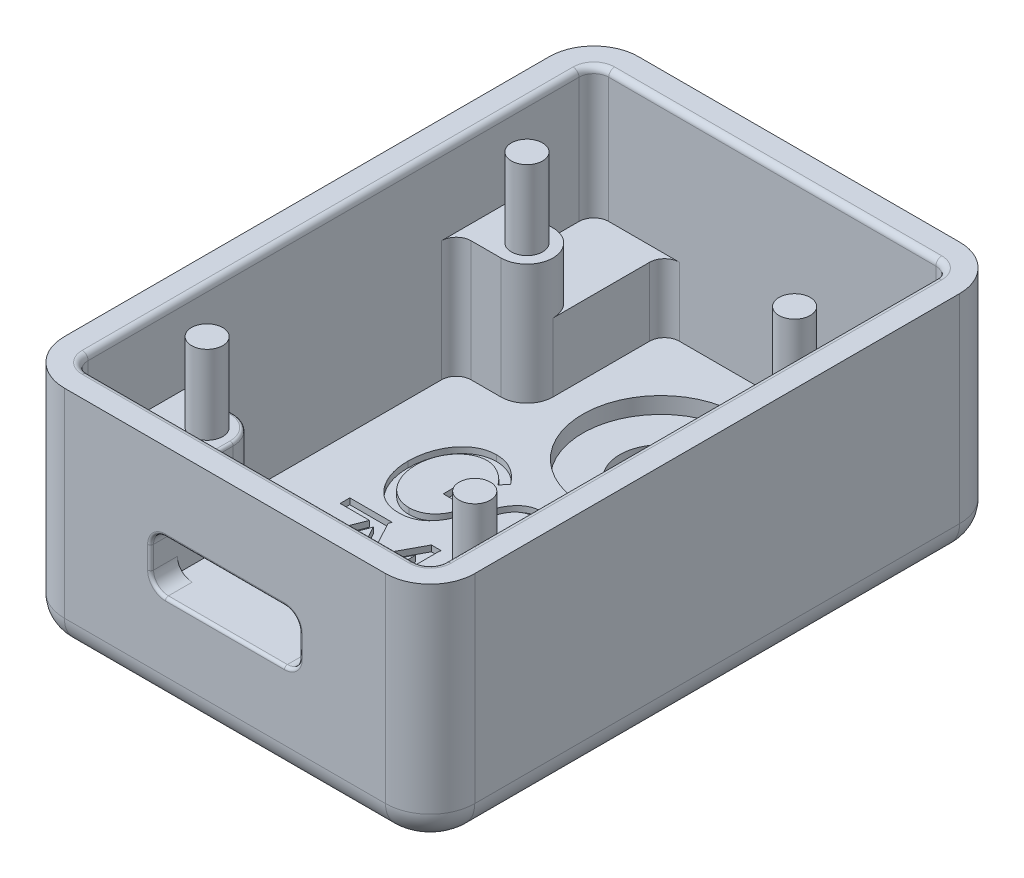
from build123d import *

# Parameters (mm, degrees)
SKETCH_1_3_W        = 27.6
SKETCH_1_3_H        = 38.61
EXTRUDE_2_DEPTH     = 5.3
SKETCH_1_3_R        = 1.05
EXTRUDE_2_2_DEPTH   = 5.3
EXTRUDE_2_3_DEPTH   = 5.3
EXTRUDE_2_4_DEPTH   = 5.3
EXTRUDE_2_5_DEPTH   = 5.3
EXTRUDE_START       = -8.1
SKETCH_1_W          = 27.6
SKETCH_1_H          = 38.61
EXTRUDE_3_DEPTH     = 8.1
EXTRUDE_4_DEPTH     = 4.6
CUT_EXTRUDE_1_DEPTH = 2.3
SKETCH_1_6_W        = 27.6
SKETCH_1_6_H        = 38.61
EXTRUDE_5_DEPTH     = 2
EXTRUDE_6_DEPTH     = 4.6
FILLET_1_R          = 3
FILLET_2_R          = 0.2
FILLET_3_R          = 2
SKETCH_3_7_R        = 2.75
CUT_EXTRUDE_2_DEPTH = 3
SKETCH_3_8_R        = 5.25
SKETCH_3_8_R_2      = 2.75
CUT_EXTRUDE_3_DEPTH = 1.1
FILLET_4_R          = 0.4
FILLET_5_R          = 0.4
CUT_EXTRUDE_4_DEPTH = 0.4
CUT_EXTRUDE_5_DEPTH = 0.4


with BuildPart() as part:
    # 草图1<3> → 凸台-拉伸2 (new body)
    with BuildSketch(Plane(origin=(0, 0, 0), x_dir=(1, 0, 0), z_dir=(0, 1, 0))):
        with Locations((0, 0.75)):
            Rectangle(SKETCH_1_3_W, SKETCH_1_3_H)
        with BuildLine():
            ThreePointArc((-12, 17.255), (-11.707106781, 17.962106781), (-11, 18.255))
            Line((-11, 18.255), (11, 18.255))
            ThreePointArc((11, 18.255), (11.707106781, 17.962106781), (12, 17.255))
            Line((12, 17.255), (12, -15.755))
            ThreePointArc((12, -15.755), (11.707106781, -16.462106781), (11, -16.755))
            Line((11, -16.755), (-11, -16.755))
            ThreePointArc((-11, -16.755), (-11.707106781, -16.462106781), (-12, -15.755))
            Line((-12, -15.755), (-12, 17.255))
        make_face(mode=Mode.SUBTRACT)
    extrude(amount=EXTRUDE_2_DEPTH)

    # 草图1 → 凸台-拉伸3 (add)
    with BuildSketch(Plane(origin=(0, 0, 0), x_dir=(1, 0, 0), z_dir=(0, 1, 0)).offset(EXTRUDE_START)):
        with Locations((0, 0.75)):
            Rectangle(SKETCH_1_W, SKETCH_1_H)
        with BuildLine():
            ThreePointArc((-12, 17.255), (-11.707106781, 17.962106781), (-11, 18.255))
            Line((-11, 18.255), (11, 18.255))
            ThreePointArc((11, 18.255), (11.707106781, 17.962106781), (12, 17.255))
            Line((12, 17.255), (12, 13.505))
            ThreePointArc((12, 13.505), (11.707106781, 12.797893219), (11, 12.505))
            Line((11, 12.505), (9, 12.505))
            ThreePointArc((9, 12.505), (7.25, 10.755), (9, 9.005))
            Line((9, 9.005), (11, 9.005))
            ThreePointArc((11, 9.005), (11.707106781, 8.712106781), (12, 8.005))
            Line((12, 8.005), (12, -8.005))
            ThreePointArc((12, -8.005), (11.707106781, -8.712106781), (11, -9.005))
            Line((11, -9.005), (9, -9.005))
            ThreePointArc((9, -9.005), (7.762563133, -9.517563133), (7.25, -10.755))
            Line((7.25, -10.755), (7.25, -12.755))
            ThreePointArc((7.25, -12.755), (6.957106781, -13.462106781), (6.25, -13.755))
            Line((6.25, -13.755), (5, -13.755))
            Line((5, -13.755), (5, -16.755))
            Line((5, -16.755), (-5, -16.755))
            Line((-5, -16.755), (-5, -13.755))
            Line((-5, -13.755), (-6.25, -13.755))
            ThreePointArc((-6.25, -13.755), (-6.957106781, -13.462106781), (-7.25, -12.755))
            Line((-7.25, -12.755), (-7.25, -10.755))
            ThreePointArc((-7.25, -10.755), (-7.762563133, -9.517563133), (-9, -9.005))
            Line((-9, -9.005), (-11, -9.005))
            ThreePointArc((-11, -9.005), (-11.707106781, -8.712106781), (-12, -8.005))
            Line((-12, -8.005), (-12, 8.005))
            ThreePointArc((-12, 8.005), (-11.707106781, 8.712106781), (-11, 9.005))
            Line((-11, 9.005), (-9, 9.005))
            ThreePointArc((-9, 9.005), (-7.25, 10.755), (-9, 12.505))
            Line((-9, 12.505), (-11, 12.505))
            ThreePointArc((-11, 12.505), (-11.707106781, 12.797893219), (-12, 13.505))
            Line((-12, 13.505), (-12, 17.255))
        make_face(mode=Mode.SUBTRACT)
    extrude(amount=EXTRUDE_3_DEPTH)

    # 草图1<5> → 凸台-拉伸4 (add)
    with BuildSketch(Plane(origin=(0, 0, 0), x_dir=(1, 0, 0), z_dir=(0, 1, 0)).offset(EXTRUDE_START)):
        with BuildLine():
            Line((7.876917987, -9.412916995), (7.535564854, -9.005))
            Line((7.535564854, -9.005), (-9, -9.005))
            ThreePointArc((-9, -9.005), (-7.762563133, -9.517563133), (-7.25, -10.755))
            Line((-7.25, -10.755), (-7.25, -12.755))
            ThreePointArc((-7.25, -12.755), (-6.957106781, -13.462106781), (-6.25, -13.755))
            Line((-6.25, -13.755), (-5, -13.755))
            Line((-5, -13.755), (-5, -16.755))
            Line((-5, -16.755), (5, -16.755))
            Line((5, -16.755), (5, -13.755))
            Line((5, -13.755), (6.25, -13.755))
            ThreePointArc((6.25, -13.755), (6.957106781, -13.462106781), (7.25, -12.755))
            Line((7.25, -12.755), (7.25, -10.755))
            ThreePointArc((7.25, -10.755), (7.414456951, -10.0143562), (7.876917987, -9.412916995))
        make_face()
        with BuildLine():
            Line((9, -9.005), (7.535564854, -9.005))
            Line((7.535564854, -9.005), (7.876917987, -9.412916995))
            ThreePointArc((7.876917987, -9.412916995), (8.402566012, -9.110137504), (9, -9.005))
        make_face()
    extrude(amount=EXTRUDE_4_DEPTH)

    # 草图2 → 切除-拉伸1 (cut)
    with BuildSketch(Plane.XY.offset(18.555)):
        with BuildLine():
            Line((-5, -1), (-5, -2.5))
            ThreePointArc((-5, -2.5), (-4.707106781, -3.207106781), (-4, -3.5))
            Line((-4, -3.5), (4, -3.5))
            ThreePointArc((4, -3.5), (4.707106781, -3.207106781), (5, -2.5))
            Line((5, -2.5), (5, -1))
            ThreePointArc((5, -1), (4.707106781, -0.292893219), (4, 0))
            Line((4, 0), (-4, 0))
            ThreePointArc((-4, 0), (-4.707106781, -0.292893219), (-5, -1))
        make_face()
    extrude(amount=-CUT_EXTRUDE_1_DEPTH, mode=Mode.SUBTRACT)

    # 草图1<6> → 凸台-拉伸5 (add)
    with BuildSketch(Plane(origin=(0, 0, 0), x_dir=(1, 0, 0), z_dir=(0, 1, 0)).offset(EXTRUDE_START)):
        with Locations((0, 0.75)):
            Rectangle(SKETCH_1_6_W, SKETCH_1_6_H)
    extrude(amount=-EXTRUDE_5_DEPTH)

    # 草图3 → 凸台-拉伸6 (add)
    with BuildSketch(Plane(origin=(0, -8.1, 0), x_dir=(1, 0, 0), z_dir=(0, 1, 0))):
        with BuildLine():
            Line((-6.25, 18.255), (-11, 18.255))
            ThreePointArc((-11, 18.255), (-11.707106781, 17.962106781), (-12, 17.255))
            Line((-12, 17.255), (-12, 13.505))
            ThreePointArc((-12, 13.505), (-11.707106781, 12.797893219), (-11, 12.505))
            Line((-11, 12.505), (-9, 12.505))
            ThreePointArc((-9, 12.505), (-7.762563133, 11.992436867), (-7.25, 10.755))
            Line((-7.25, 10.755), (-7.25, 17.255))
            ThreePointArc((-7.25, 17.255), (-6.957106781, 17.962106781), (-6.25, 18.255))
        make_face()
        with BuildLine():
            Line((11, 18.255), (6.25, 18.255))
            ThreePointArc((6.25, 18.255), (6.957106781, 17.962106781), (7.25, 17.255))
            Line((7.25, 17.255), (7.25, 10.755))
            ThreePointArc((7.25, 10.755), (7.762563133, 11.992436867), (9, 12.505))
            Line((9, 12.505), (11, 12.505))
            ThreePointArc((11, 12.505), (11.707106781, 12.797893219), (12, 13.505))
            Line((12, 13.505), (12, 17.255))
            ThreePointArc((12, 17.255), (11.707106781, 17.962106781), (11, 18.255))
        make_face()
    extrude(amount=EXTRUDE_6_DEPTH)

    # 圆角1
    fillet_1_edges = [part.edges().sort_by_distance(p)[0] for p in [
        (13.8, -2.4, 18.555),
        (-13.8, -2.4, 18.555),
        (-13.8, -2.4, -20.055),
        (13.8, -2.4, -20.055),
    ]]
    fillet(fillet_1_edges, radius=FILLET_1_R)

    # 圆角2
    # the kernel refuses this fillet: 0.2 mm, written as the material it takes off along each edge
    with BuildSketch(Plane(origin=(5.2, -0.2, 13.955), x_dir=(0, 1, 0), z_dir=(0, 0, -1))) as fillet_2_piece_1_section:
        Polygon((0, 0), (FILLET_2_R * 1.02, 0), (FILLET_2_R * 1.02, -FILLET_2_R * 1.02), (0, -FILLET_2_R * 1.02), align=None)
    fillet_2_piece_1 = extrude(amount=FILLET_2_R * 1.02, mode=Mode.PRIVATE)
    fillet_2_piece_1 = fillet_2_piece_1 - Plane(origin=(5.2, -0.2, 13.955), x_dir=(0.7071067811865475, -0.7071067811865475, 0), z_dir=(0, 0, -1)) * Sphere(FILLET_2_R, mode=Mode.PRIVATE)
    add(fillet_2_piece_1, mode=Mode.SUBTRACT)
    with BuildSketch(Plane(origin=(-5.2, -0.2, 13.955), x_dir=(1, 0, 0), z_dir=(0, 0, -1))) as fillet_2_piece_2_section:
        Polygon((0, 0), (FILLET_2_R * 1.02, 0), (FILLET_2_R * 1.02, -FILLET_2_R * 1.02), (0, -FILLET_2_R * 1.02), align=None)
    fillet_2_piece_2 = extrude(amount=FILLET_2_R * 1.02, mode=Mode.PRIVATE)
    fillet_2_piece_2 = fillet_2_piece_2 - Plane(origin=(-5.2, -0.2, 13.955), x_dir=(-0.7071067811865475, -0.7071067811865475, 0), z_dir=(0, 0, -1)) * Sphere(FILLET_2_R, mode=Mode.PRIVATE)
    add(fillet_2_piece_2, mode=Mode.SUBTRACT)
    with BuildSketch(Plane(origin=(5, -3.5, 13.755), x_dir=(0, 0, 1), z_dir=(0, 1, 0))) as fillet_2_piece_3:
        with BuildLine():
            CenterArc((FILLET_2_R, FILLET_2_R), FILLET_2_R, 180, 90)
            Line((0, FILLET_2_R), (0, 0))
            Line((0, 0), (FILLET_2_R, 0))
        make_face()
    extrude(amount=3.3, mode=Mode.SUBTRACT)
    with BuildSketch(Plane(origin=(-5, -3.5, 13.755), x_dir=(0, 0, 1), z_dir=(0, 1, 0))) as fillet_2_piece_4:
        with BuildLine():
            CenterArc((FILLET_2_R, -FILLET_2_R), FILLET_2_R, 90, 90)
            Line((0, -FILLET_2_R), (0, 0))
            Line((0, 0), (FILLET_2_R, 0))
        make_face()
    extrude(amount=3.3, mode=Mode.SUBTRACT)
    with BuildSketch(Plane(origin=(4, -1, 18.555), x_dir=(1, 0, 0), z_dir=(0, -1, 0))) as fillet_2_piece_5:
        with BuildLine():
            CenterArc((1 + FILLET_2_R, -FILLET_2_R), FILLET_2_R, 90, 90)
            Line((1, -FILLET_2_R), (1, 0))
            Line((1, 0), (1 + FILLET_2_R, 0))
        make_face()
    revolve(axis=Axis((4, -1, 18.555), (0, 0, 1)), revolution_arc=90, mode=Mode.SUBTRACT)
    with BuildSketch(Plane(origin=(-4, -2.5, 18.555), x_dir=(-1, 0, 0), z_dir=(0, 1, 0))) as fillet_2_piece_6:
        with BuildLine():
            CenterArc((1 + FILLET_2_R, -FILLET_2_R), FILLET_2_R, 90, 90)
            Line((1, -FILLET_2_R), (1, 0))
            Line((1, 0), (1 + FILLET_2_R, 0))
        make_face()
    revolve(axis=Axis((-4, -2.5, 18.555), (0, 0, 1)), revolution_arc=90, mode=Mode.SUBTRACT)
    with BuildSketch(Plane(origin=(-5, -1, 18.555), x_dir=(-1, 0, 0), z_dir=(0, -1, 0)), Plane(origin=(5, -2.5, 18.555), x_dir=(1, 0, 0), z_dir=(0, 1, 0))) as fillet_2_piece_7:
        with BuildLine():
            CenterArc((FILLET_2_R, FILLET_2_R), FILLET_2_R, 180, 90)
            Line((0, FILLET_2_R), (0, 0))
            Line((0, 0), (FILLET_2_R, 0))
        make_face()
    extrude(amount=1.5, mode=Mode.SUBTRACT)
    with BuildSketch(Plane(origin=(4, 0, 18.555), x_dir=(0, 1, 0), z_dir=(-1, 0, 0)), Plane(origin=(-4, -3.5, 18.555), x_dir=(0, -1, 0), z_dir=(1, 0, 0))) as fillet_2_piece_8:
        with BuildLine():
            CenterArc((FILLET_2_R, FILLET_2_R), FILLET_2_R, 180, 90)
            Line((0, FILLET_2_R), (0, 0))
            Line((0, 0), (FILLET_2_R, 0))
        make_face()
    extrude(amount=8, mode=Mode.SUBTRACT)
    with BuildSketch(Plane(origin=(-4, -1, 18.555), x_dir=(0, 1, 0), z_dir=(1, 0, 0))) as fillet_2_piece_9:
        with BuildLine():
            CenterArc((1 + FILLET_2_R, -FILLET_2_R), FILLET_2_R, 90, 90)
            Line((1, -FILLET_2_R), (1, 0))
            Line((1, 0), (1 + FILLET_2_R, 0))
        make_face()
    revolve(axis=Axis((-4, -1, 18.555), (0, 0, 1)), revolution_arc=90, mode=Mode.SUBTRACT)
    with BuildSketch(Plane(origin=(4, -2.5, 18.555), x_dir=(0, -1, 0), z_dir=(-1, 0, 0))) as fillet_2_piece_10:
        with BuildLine():
            CenterArc((1 + FILLET_2_R, -FILLET_2_R), FILLET_2_R, 90, 90)
            Line((1, -FILLET_2_R), (1, 0))
            Line((1, 0), (1 + FILLET_2_R, 0))
        make_face()
    revolve(axis=Axis((4, -2.5, 18.555), (0, 0, 1)), revolution_arc=90, mode=Mode.SUBTRACT)
    with BuildSketch(Plane(origin=(9, 0, 10.755), x_dir=(0, 0, -1), z_dir=(1, 0, 0))) as fillet_2_piece_11:
        with BuildLine():
            CenterArc((1.75 - FILLET_2_R, -FILLET_2_R), FILLET_2_R, 360, 90)
            Line((1.75, -FILLET_2_R), (1.75, 0))
            Line((1.75, 0), (1.75 - FILLET_2_R, 0))
        make_face()
    revolve(axis=Axis((9, 0, 10.755), (0, 1, 0)), revolution_arc=90, mode=Mode.SUBTRACT)
    with BuildSketch(Plane(origin=(7.25, 0, 10.755), x_dir=(1, 0, 0), z_dir=(0, 0, 1)), Plane(origin=(11, 0, 9.005), x_dir=(0, 0, 1), z_dir=(-1, 0, 0)), Plane(origin=(-7.25, 0, 12.755), x_dir=(-1, 0, 0), z_dir=(0, 0, -1)), Plane(origin=(-9, 0, 9.005), x_dir=(0, 0, 1), z_dir=(-1, 0, 0))) as fillet_2_piece_12:
        with BuildLine():
            CenterArc((FILLET_2_R, -FILLET_2_R), FILLET_2_R, 90, 90)
            Line((0, -FILLET_2_R), (0, 0))
            Line((0, 0), (FILLET_2_R, 0))
        make_face()
    extrude(amount=2, mode=Mode.SUBTRACT)
    with BuildSketch(Plane(origin=(6.25, 0, 12.755), x_dir=(1, 0, 0), z_dir=(0, 0, -1))) as fillet_2_piece_13:
        with BuildLine():
            CenterArc((1 + FILLET_2_R, FILLET_2_R), FILLET_2_R, 180, 90)
            Line((1, FILLET_2_R), (1, 0))
            Line((1, 0), (1 + FILLET_2_R, 0))
        make_face()
    revolve(axis=Axis((6.25, 0, 12.755), (0, -1, 0)), revolution_arc=90, mode=Mode.SUBTRACT)
    with BuildSketch(Plane(origin=(6.25, 0, 13.755), x_dir=(0, 0, 1), z_dir=(-1, 0, 0)), Plane(origin=(-5.2, 0, 13.755), x_dir=(0, 0, 1), z_dir=(-1, 0, 0))) as fillet_2_piece_14:
        with BuildLine():
            CenterArc((FILLET_2_R, -FILLET_2_R), FILLET_2_R, 90, 90)
            Line((0, -FILLET_2_R), (0, 0))
            Line((0, 0), (FILLET_2_R, 0))
        make_face()
    extrude(amount=1.05, mode=Mode.SUBTRACT)
    with BuildSketch(Plane(origin=(5, 0, 13.955), x_dir=(0, -1, 0), z_dir=(0, 0, 1)), Plane(origin=(-5, 0, 16.755), x_dir=(0, -1, 0), z_dir=(0, 0, -1))) as fillet_2_piece_15:
        with BuildLine():
            CenterArc((FILLET_2_R, FILLET_2_R), FILLET_2_R, 180, 90)
            Line((0, FILLET_2_R), (0, 0))
            Line((0, 0), (FILLET_2_R, 0))
        make_face()
    extrude(amount=2.8, mode=Mode.SUBTRACT)
    with BuildSketch(Plane(origin=(11, 0, 8.005), x_dir=(0.8774862496148653, 0, -0.47960179496832406), z_dir=(-0.47960179496832406, 0, -0.8774862496148653))) as fillet_2_piece_16_section:
        with BuildLine():
            CenterArc((1 + FILLET_2_R, FILLET_2_R), FILLET_2_R, 180, 90)
            Line((1 + FILLET_2_R, 0), (1, 0))
            Line((1, 0), (1, FILLET_2_R))
        make_face()
    fillet_2_piece_16 = revolve(axis=Axis((11, 0, 8.005), (0, -1, 0)), revolution_arc=118.659397847, mode=Mode.PRIVATE)
    fillet_2_piece_16 = split(fillet_2_piece_16, bisect_by=Plane(origin=(12, -0.057092047, 8.752476907), z_dir=(-1, 0, 0)), keep=Keep.TOP, mode=Mode.PRIVATE)
    add(fillet_2_piece_16, mode=Mode.SUBTRACT)
    with BuildSketch(Plane(origin=(-6.25, 0, 12.755), x_dir=(0, 0, 1), z_dir=(1, 0, 0))) as fillet_2_piece_17:
        with BuildLine():
            CenterArc((1 + FILLET_2_R, FILLET_2_R), FILLET_2_R, 180, 90)
            Line((1, FILLET_2_R), (1, 0))
            Line((1, 0), (1 + FILLET_2_R, 0))
        make_face()
    revolve(axis=Axis((-6.25, 0, 12.755), (0, -1, 0)), revolution_arc=90, mode=Mode.SUBTRACT)
    with BuildSketch(Plane(origin=(-9, 0, 10.755), x_dir=(1, 0, 0), z_dir=(0, 0, 1))) as fillet_2_piece_18:
        with BuildLine():
            CenterArc((1.75 - FILLET_2_R, -FILLET_2_R), FILLET_2_R, 360, 90)
            Line((1.75, -FILLET_2_R), (1.75, 0))
            Line((1.75, 0), (1.75 - FILLET_2_R, 0))
        make_face()
    revolve(axis=Axis((-9, 0, 10.755), (0, 1, 0)), revolution_arc=90, mode=Mode.SUBTRACT)
    with BuildSketch(Plane(origin=(-11, 0, 8.005), x_dir=(0, 0, 1), z_dir=(1, 0, 0))) as fillet_2_piece_19_section:
        with BuildLine():
            CenterArc((1 + FILLET_2_R, FILLET_2_R), FILLET_2_R, 180, 90)
            Line((1, FILLET_2_R), (1, 0))
            Line((1, 0), (1 + FILLET_2_R, 0))
        make_face()
    fillet_2_piece_19 = revolve(axis=Axis((-11, 0, 8.005), (0, -1, 0)), revolution_arc=118.659397847, mode=Mode.PRIVATE)
    fillet_2_piece_19 = split(fillet_2_piece_19, bisect_by=Plane(origin=(-12, -0.03305376, 9.046826164), z_dir=(1, 0, 0)), keep=Keep.TOP, mode=Mode.PRIVATE)
    add(fillet_2_piece_19, mode=Mode.SUBTRACT)

    # 圆角3
    fillet_3_edges = [part.edges().sort_by_distance(p)[0] for p in [
        (-13.8, -10.1, -0.75),
        (13.8, -10.1, -0.75),
        (0, -10.1, 18.555),
        (0, -10.1, -20.055),
        (-12.921320344, -10.1, 17.676320344),
        (12.921320344, -10.1, 17.676320344),
        (12.921320344, -10.1, -19.176320344),
        (-12.921320344, -10.1, -19.176320344),
    ]]
    fillet(fillet_3_edges, radius=FILLET_3_R)

    # 草图3<7> → 切除-拉伸2 (cut)
    with BuildSketch(Plane(origin=(0, -8.1, 0), x_dir=(1, 0, 0), z_dir=(0, 1, 0))):
        with Locations(Location((0, 10.755, 0), (0, 0, 270))):
            Circle(SKETCH_3_7_R)
    extrude(amount=-CUT_EXTRUDE_2_DEPTH, mode=Mode.SUBTRACT)

    # 草图3<8> → 切除-拉伸3 (cut)
    with BuildSketch(Plane(origin=(0, -8.1, 0), x_dir=(1, 0, 0), z_dir=(0, 1, 0))):
        with Locations(Location((0, 10.755, 0), (0, 0, 270))):
            Circle(SKETCH_3_8_R)
        with Locations(Location((0, 10.755, 0), (0, 0, 270))):
            Circle(SKETCH_3_8_R_2, mode=Mode.SUBTRACT)
    extrude(amount=-CUT_EXTRUDE_3_DEPTH, mode=Mode.SUBTRACT)

    # 圆角4
    fillet_4_edges = [part.edges().sort_by_distance(p)[0] for p in [
        (0, -10.1, -13.505),
    ]]
    fillet(fillet_4_edges, radius=FILLET_4_R)

    # 圆角5
    fillet_5_edges = [part.edges().sort_by_distance(p)[0] for p in [
        (12, 5.3, -0.75),
        (11.707106781, 5.3, 16.462106781),
        (0, 5.3, 16.755),
        (-11.707106781, 5.3, 16.462106781),
        (-12, 5.3, -0.75),
        (-11.707106781, 5.3, -17.962106781),
        (0, 5.3, -18.255),
        (11.707106781, 5.3, -17.962106781),
    ]]
    fillet(fillet_5_edges, radius=FILLET_5_R)

    # 草图4 → 切除-拉伸4 (cut)
    # profile 1 of 4: a face of its own
    with BuildSketch(Plane(origin=(0, -8.1, 0), x_dir=(1, 0, 0), z_dir=(0, 1, 0))):
        with BuildLine():
            Line((-3.590091151, 4.248976752), (-3.970429693, 3.785955919))
            add(Edge.make_bspline(
                [(-3.970429693, 3.785955919), (-4.037268914, 3.86860631), (-4.167484556, 4.029625147), (-4.381793299, 4.244574793), (-4.606978121, 4.42652171), (-4.839336209, 4.576328742), (-5.073951621, 4.695723028), (-5.308514002, 4.780175703), (-5.540173518, 4.834597756), (-5.694606155, 4.841099815), (-5.770359581, 4.844289252)],
                knots=[0, 0, 0, 0, 1.180897879, 2.300615913, 3.366389015, 4.392591617, 5.368437861, 6.285267508, 7.158876892, 8, 8, 8, 8], degree=3))
            add(Edge.make_bspline(
                [(-5.770359581, 4.844289252), (-5.817069945, 4.843567106), (-5.909994566, 4.842130484), (-6.048046267, 4.822645863), (-6.18438916, 4.795524642), (-6.31903187, 4.755150037), (-6.452367609, 4.704696653), (-6.58392555, 4.641603985), (-6.713832151, 4.568021811), (-6.840173578, 4.482402267), (-6.963641544, 4.389426747), (-7.079108807, 4.28543502), (-7.189354106, 4.175084641), (-7.2907077, 4.054715547), (-7.386409498, 3.92769037), (-7.474681051, 3.792279004), (-7.55431217, 3.648079314), (-7.652350453, 3.447323234), (-7.754299715, 3.185363029), (-7.840173571, 2.859713522), (-7.894588505, 2.525493885), (-7.90140157, 2.299577239), (-7.904834741, 2.185735566)],
                knots=[0, 0, 0, 0, 0.742195851, 1.476508881, 2.213078346, 2.951281721, 3.708907221, 4.477997883, 5.269176095, 6.080806104, 6.903452709, 7.724910218, 8.549764533, 9.38205395, 10.224901256, 11.077722799, 11.950072611, 12.842695263, 14.629531552, 16.409024752, 18.190471412, 20, 20, 20, 20], degree=3))
            add(Edge.make_bspline(
                [(-7.904834741, 2.185735566), (-7.903766457, 2.127195017), (-7.901634663, 2.01037557), (-7.887242044, 1.836286362), (-7.864388761, 1.664337229), (-7.832765514, 1.49432663), (-7.790496159, 1.326733211), (-7.73964663, 1.161107644), (-7.679681635, 0.998088531), (-7.611368043, 0.838221313), (-7.534536244, 0.683742681), (-7.448589141, 0.537368493), (-7.357921101, 0.398559622), (-7.258451158, 0.26923917), (-7.154090381, 0.14679802), (-7.03961983, 0.035119282), (-6.920265073, -0.07000666), (-6.793335829, -0.165000161), (-6.661123655, -0.249616486), (-6.526473689, -0.325825656), (-6.387304238, -0.387842756), (-6.245178796, -0.43878873), (-6.100514493, -0.480333525), (-5.952152984, -0.507192999), (-5.801405472, -0.526682916), (-5.699614565, -0.528081735), (-5.648244196, -0.528787671)],
                knots=[0, 0, 0, 0, 1.075648671, 2.146489633, 3.207621231, 4.262009588, 5.322110962, 6.381840063, 7.444229469, 8.512289095, 9.575021281, 10.611993966, 11.629793255, 12.619316909, 13.608073431, 14.583229653, 15.555112222, 16.529022636, 17.492908616, 18.438097579, 19.369212982, 20.288485365, 21.211020687, 22.130920189, 23.056739734, 24, 24, 24, 24], degree=3))
            add(Edge.make_bspline(
                [(-5.648244196, -0.528787671), (-5.586245073, -0.527056469), (-5.464260062, -0.52365028), (-5.285344173, -0.49735207), (-5.113659215, -0.455986559), (-4.949846036, -0.395188367), (-4.792865222, -0.318806283), (-4.64289298, -0.22542814), (-4.501546978, -0.113861253), (-4.368342058, 0.013130948), (-4.24564184, 0.153900711), (-4.134540487, 0.305821463), (-4.036580785, 0.467497625), (-3.951668914, 0.63919933), (-3.88250654, 0.821470317), (-3.824955576, 1.013552652), (-3.779918292, 1.215435345), (-3.762002753, 1.35449423), (-3.752911664, 1.425058483)],
                knots=[0, 0, 0, 0, 0.992732885, 1.953229764, 2.890514293, 3.816609624, 4.746085783, 5.682705685, 6.640557555, 7.625359646, 8.626536552, 9.627713458, 10.636418116, 11.650913816, 12.691491505, 13.75510899, 14.860849082, 16, 16, 16, 16], degree=3))
            Line((-3.752911664, 1.425058483), (-5.299706536, 1.425058483))
            Line((-5.299706536, 1.425058483), (-5.299706536, 2.076340534))
            Line((-5.299706536, 2.076340534), (-3.264450126, 2.076340534))
            add(Edge.make_bspline(
                [(-3.264450126, 2.076340534), (-3.266781118, 1.955008717), (-3.271337241, 1.717855355), (-3.30292307, 1.371781229), (-3.356675444, 1.045124129), (-3.428382129, 0.73736964), (-3.521287099, 0.448796583), (-3.634098973, 0.179333085), (-3.768732371, -0.070444666), (-3.921541226, -0.300040806), (-4.091896723, -0.506543018), (-4.276761073, -0.687428033), (-4.476488804, -0.840312635), (-4.690886839, -0.964489286), (-4.91879673, -1.062183294), (-5.160784992, -1.130508252), (-5.416559495, -1.172251665), (-5.591688729, -1.177423075), (-5.681317113, -1.180069722)],
                knots=[0, 0, 0, 0, 1.279979538, 2.501828927, 3.662287385, 4.770080211, 5.832462613, 6.856844025, 7.847542677, 8.821456207, 9.761900772, 10.666623651, 11.544302252, 12.408204966, 13.273981784, 14.15325484, 15.054864909, 16, 16, 16, 16], degree=3))
            add(Edge.make_bspline(
                [(-5.681317113, -1.180069722), (-5.736047147, -1.179032528), (-5.844411972, -1.176978896), (-6.004923252, -1.162407979), (-6.161470815, -1.140313842), (-6.31335342, -1.106461196), (-6.461176263, -1.065212624), (-6.604063975, -1.012326059), (-6.742954782, -0.951146361), (-6.878249429, -0.881607377), (-7.008047049, -0.800587196), (-7.134123982, -0.711839898), (-7.255622578, -0.613198839), (-7.372344567, -0.505173345), (-7.484906099, -0.387482415), (-7.592528611, -0.259980243), (-7.697419806, -0.124307777), (-7.761657679, -0.028005722), (-7.794167674, 0.02073156)],
                knots=[0, 0, 0, 0, 1.032382545, 2.044105334, 3.038476821, 4.012827536, 4.97754274, 5.931586725, 6.884288403, 7.839538852, 8.798533035, 9.768407888, 10.746592774, 11.748528567, 12.766901797, 13.816738798, 14.895078446, 16, 16, 16, 16], degree=3))
            add(Edge.make_bspline(
                [(-7.794167674, 0.02073156), (-7.842070399, 0.098461677), (-7.937948178, 0.254039276), (-8.058923312, 0.50003576), (-8.163191374, 0.754348296), (-8.246465546, 1.018404565), (-8.313187602, 1.291103885), (-8.359771065, 1.573014544), (-8.388631595, 1.863726409), (-8.391727942, 2.060584082), (-8.39329628, 2.160294861)],
                knots=[0, 0, 0, 0, 0.972045947, 1.945559608, 2.915893918, 3.89712903, 4.891732452, 5.90371772, 6.93820781, 8, 8, 8, 8], degree=3))
            add(Edge.make_bspline(
                [(-8.39329628, 2.160294861), (-8.392451829, 2.234954934), (-8.390775196, 2.383190373), (-8.373270186, 2.603470806), (-8.347053144, 2.81960006), (-8.309625772, 3.031772089), (-8.263445687, 3.240163877), (-8.203806916, 3.444410063), (-8.136109113, 3.645356183), (-8.055391689, 3.840605458), (-7.967459744, 4.029071744), (-7.870596898, 4.208171217), (-7.764702464, 4.376063968), (-7.651863057, 4.53413171), (-7.53041819, 4.680923639), (-7.401656204, 4.817295062), (-7.265607937, 4.944087875), (-7.12033551, 5.058014324), (-6.969780032, 5.160972184), (-6.813911609, 5.250781522), (-6.652462032, 5.326024261), (-6.486816959, 5.388501847), (-6.315507728, 5.435758856), (-6.139855789, 5.469636632), (-5.95922769, 5.492656711), (-5.837000755, 5.494595125), (-5.775447722, 5.495571304)],
                knots=[0, 0, 0, 0, 1.139613768, 2.262670523, 3.371514243, 4.462374492, 5.550696422, 6.628397115, 7.709281568, 8.786379394, 9.852056274, 10.883259988, 11.892634097, 12.880693113, 13.846294527, 14.798787622, 15.742440682, 16.682668171, 17.614523987, 18.525044925, 19.425686334, 20.331084297, 21.224742707, 22.135010483, 23.060798158, 24, 24, 24, 24], degree=3))
            add(Edge.make_bspline(
                [(-5.775447722, 5.495571304), (-5.725383776, 5.494496672), (-5.625489871, 5.49235243), (-5.477201823, 5.478099441), (-5.331113948, 5.454983497), (-5.186908273, 5.423401574), (-5.045034817, 5.381459932), (-4.905502899, 5.329896015), (-4.767841932, 5.270537545), (-4.632559066, 5.199885023), (-4.498786941, 5.119565977), (-4.365867984, 5.028649612), (-4.233632184, 4.926925793), (-4.102524442, 4.813406033), (-3.972671032, 4.688106981), (-3.843404932, 4.5521638), (-3.714229192, 4.405809876), (-3.632018206, 4.301946422), (-3.590091151, 4.248976752)],
                knots=[0, 0, 0, 0, 0.919647238, 1.834996262, 2.733959633, 3.635416665, 4.54488085, 5.449260826, 6.366695346, 7.296870797, 8.250651732, 9.231496765, 10.253508801, 11.31380595, 12.415577929, 13.567028811, 14.759200909, 16, 16, 16, 16], degree=3))
        make_face()
    # profile 2 of 4: a face of its own
    with BuildSketch(Plane(origin=(0, -8.1, 0), x_dir=(1, 0, 0), z_dir=(0, 1, 0))):
        with BuildLine():
            Line((0.879331925, 3.623135406), (0.879331925, -1.017249209))
            Line((0.879331925, -1.017249209), (0.390870387, -1.017249209))
            Line((0.390870387, -1.017249209), (0.390870387, -0.214594962))
            add(Edge.make_bspline(
                [(0.390870387, -0.214594962), (0.343290975, -0.287014469), (0.251424081, -0.426842911), (0.092303488, -0.610218588), (-0.073453002, -0.765929992), (-0.250453108, -0.888869718), (-0.435944268, -0.983343097), (-0.6296653, -1.049061496), (-0.83133923, -1.092356556), (-0.969134264, -1.096540975), (-1.038897241, -1.098659466)],
                knots=[0, 0, 0, 0, 1.179334017, 2.277072125, 3.299058578, 4.27014761, 5.202761405, 6.125302315, 7.050876602, 8, 8, 8, 8], degree=3))
            add(Edge.make_bspline(
                [(-1.038897241, -1.098659466), (-1.100952596, -1.096416644), (-1.22383303, -1.091975464), (-1.404198481, -1.057802363), (-1.577344399, -1.003029541), (-1.743493877, -0.925394245), (-1.90264162, -0.82569678), (-2.054726902, -0.703784918), (-2.199179781, -0.559702853), (-2.334832881, -0.396005034), (-2.458070123, -0.216202282), (-2.568757669, -0.026515482), (-2.660205622, 0.174486433), (-2.73529728, 0.384750386), (-2.79373613, 0.604321612), (-2.836056366, 0.833044045), (-2.859899157, 1.071348908), (-2.86363952, 1.233354167), (-2.865539869, 1.315663451)],
                knots=[0, 0, 0, 0, 0.887872522, 1.758142578, 2.618128085, 3.481683386, 4.376005731, 5.300250685, 6.265959025, 7.291808604, 8.339055305, 9.383289759, 10.431679196, 11.495297482, 12.575994128, 13.680797244, 14.821693069, 16, 16, 16, 16], degree=3))
            add(Edge.make_bspline(
                [(-2.865539869, 1.315663451), (-2.863771066, 1.39629116), (-2.860280395, 1.555407094), (-2.834424723, 1.789329643), (-2.792285438, 2.01467106), (-2.734515506, 2.231243732), (-2.657442114, 2.438247016), (-2.564018744, 2.636397535), (-2.454856436, 2.826153505), (-2.329612166, 3.004469256), (-2.192463276, 3.167041333), (-2.047062975, 3.310944374), (-1.894305286, 3.432774912), (-1.733634423, 3.531174844), (-1.567483356, 3.610442385), (-1.393219689, 3.665086002), (-1.211834781, 3.697574266), (-1.088639102, 3.702200226), (-1.026176889, 3.704545663)],
                knots=[0, 0, 0, 0, 1.159290559, 2.287818926, 3.379660878, 4.453494628, 5.506844558, 6.551511375, 7.600493292, 8.650980421, 9.680735975, 10.655174849, 11.588394672, 12.48356998, 13.359156398, 14.228863471, 15.102004974, 16, 16, 16, 16], degree=3))
            add(Edge.make_bspline(
                [(-1.026176889, 3.704545663), (-0.954754791, 3.701868926), (-0.813612809, 3.696579249), (-0.60742068, 3.65417466), (-0.412961827, 3.58091152), (-0.227567357, 3.48293381), (-0.053186812, 3.35184523), (0.107907984, 3.186992113), (0.259916545, 2.990347672), (0.345960719, 2.841960444), (0.390870387, 2.764511608)],
                knots=[0, 0, 0, 0, 0.955142924, 1.887521798, 2.80119314, 3.727598216, 4.684104897, 5.707064902, 6.803231533, 8, 8, 8, 8], degree=3))
            Line((0.390870387, 2.764511608), (0.390870387, 3.623135406))
            Line((0.390870387, 3.623135406), (0.879331925, 3.623135406))
        make_face()
        with BuildLine():
            add(Edge.make_bspline(
                [(-0.991831937, 3.134673868), (-1.053577402, 3.131688354), (-1.176152967, 3.125761586), (-1.355786203, 3.079467826), (-1.526942317, 3.002670007), (-1.689583518, 2.89824055), (-1.840407797, 2.766207148), (-1.975213772, 2.608467483), (-2.094704002, 2.427003081), (-2.194189366, 2.223919856), (-2.275550729, 2.00621433), (-2.333481328, 1.77932784), (-2.371021725, 1.546301226), (-2.375048347, 1.388737519), (-2.377078331, 1.309303275)],
                knots=[0, 0, 0, 0, 0.876143593, 1.739298532, 2.615462818, 3.5308531, 4.474045836, 5.451821009, 6.468949931, 7.55154866, 8.656673038, 9.763764415, 10.872623107, 12, 12, 12, 12], degree=3))
            add(Edge.make_bspline(
                [(-2.377078331, 1.309303275), (-2.37499236, 1.230304301), (-2.370843676, 1.073187207), (-2.333896402, 0.840328296), (-2.273633419, 0.612981171), (-2.192145855, 0.393584202), (-2.09027208, 0.18925493), (-1.971909183, 0.005226564), (-1.836193206, -0.154391126), (-1.684636346, -0.287882797), (-1.522915389, -0.395664309), (-1.3520855, -0.47154659), (-1.175568374, -0.520218084), (-1.054894517, -0.525925416), (-0.994376007, -0.528787671)],
                knots=[0, 0, 0, 0, 1.119778423, 2.227071088, 3.334118807, 4.451051948, 5.540186051, 6.565939309, 7.546896586, 8.501209795, 9.421850429, 10.291284033, 11.143070857, 12, 12, 12, 12], degree=3))
            add(Edge.make_bspline(
                [(-0.994376007, -0.528787671), (-0.933465882, -0.525784934), (-0.811715179, -0.519782888), (-0.632066905, -0.472763892), (-0.457582573, -0.397285181), (-0.291866623, -0.290190776), (-0.13573401, -0.161125008), (0.001236144, -0.005731172), (0.120249644, 0.169191026), (0.217736952, 0.365093531), (0.295033077, 0.577676112), (0.350709804, 0.80452172), (0.384399643, 1.044560001), (0.388678806, 1.208701464), (0.390870387, 1.292766816)],
                knots=[0, 0, 0, 0, 0.862570292, 1.724155687, 2.61524019, 3.547403977, 4.511725999, 5.478125195, 6.473421915, 7.502977832, 8.571655993, 9.673787814, 10.808626144, 12, 12, 12, 12], degree=3))
            add(Edge.make_bspline(
                [(0.390870387, 1.292766816), (0.38972766, 1.356846471), (0.38748236, 1.482754057), (0.367472027, 1.667568336), (0.337703051, 1.84460613), (0.29463035, 2.013819984), (0.236692875, 2.174210723), (0.168256124, 2.327129988), (0.087777482, 2.472390076), (-0.005646839, 2.607033634), (-0.108268589, 2.729609314), (-0.215799732, 2.83907424), (-0.331204274, 2.929832864), (-0.452010923, 3.004362959), (-0.578306732, 3.064185322), (-0.711859926, 3.103785234), (-0.849942384, 3.131159248), (-0.94420643, 3.133494179), (-0.991831937, 3.134673868)],
                knots=[0, 0, 0, 0, 1.20221804, 2.362190828, 3.48462824, 4.569282157, 5.633932456, 6.681042011, 7.71052723, 8.745747275, 9.751336919, 10.707874985, 11.620059176, 12.498976955, 13.367640915, 14.233493954, 15.107499117, 16, 16, 16, 16], degree=3))
        make_face(mode=Mode.SUBTRACT)
    # profile 3 of 4: a face of its own
    with BuildSketch(Plane(origin=(0, -8.1, 0), x_dir=(1, 0, 0), z_dir=(0, 1, 0))):
        Polygon((3.557729361, 5.332750791), (5.674396028, -1.017249209), (5.142685291, -1.017249209), (4.464690499, 1.018007201), (2.569357967, 1.018007201), (1.891363175, -1.017249209), (1.359652438, -1.017249209), (3.476319105, 5.332750791), align=None)
        Polygon((3.517024233, 3.859733964), (2.786875996, 1.669289252), (4.24717247, 1.669289252), align=None, mode=Mode.SUBTRACT)
    # profile 4 of 4: a face of its own
    with BuildSketch(Plane(origin=(0, -8.1, 0), x_dir=(1, 0, 0), z_dir=(0, 1, 0))):
        with BuildLine():
            Line((8.108562695, 3.044359364), (7.808362374, 2.646212329))
            add(Edge.make_bspline(
                [(7.808362374, 2.646212329), (7.778811385, 2.684825088), (7.722070481, 2.758965509), (7.631516817, 2.858561783), (7.54133607, 2.942885643), (7.452136293, 3.012225594), (7.363516987, 3.067360151), (7.274253929, 3.105398343), (7.18552821, 3.130044506), (7.126274949, 3.133153355), (7.097294666, 3.134673868)],
                knots=[0, 0, 0, 0, 1.306439345, 2.508496321, 3.613260685, 4.620812336, 5.541400319, 6.409338993, 7.222020771, 8, 8, 8, 8], degree=3))
            add(Edge.make_bspline(
                [(7.097294666, 3.134673868), (7.061786644, 3.132617265), (6.991031373, 3.128519163), (6.889956184, 3.090719378), (6.797157848, 3.030328041), (6.716406218, 2.947725637), (6.648788573, 2.851281834), (6.597451861, 2.745092462), (6.567697065, 2.630004126), (6.563768102, 2.550553678), (6.561767823, 2.510104557)],
                knots=[0, 0, 0, 0, 0.934124342, 1.861388436, 2.807960774, 3.836490042, 4.888784344, 5.904760768, 6.933290036, 8, 8, 8, 8], degree=3))
            add(Edge.make_bspline(
                [(6.561767823, 2.510104557), (6.562916179, 2.473444742), (6.56520179, 2.400479513), (6.593716659, 2.293733619), (6.631494701, 2.187549301), (6.671204347, 2.122389466), (6.691515419, 2.089060887)],
                knots=[0, 0, 0, 0, 0.98233681, 1.955177088, 2.954094317, 4, 4, 4, 4], degree=3))
            add(Edge.make_bspline(
                [(6.691515419, 2.089060887), (6.718658588, 2.053140727), (6.779106746, 1.973146105), (6.900236674, 1.858316152), (7.056691465, 1.7359371), (7.174814687, 1.654613953), (7.238490579, 1.61077563)],
                knots=[0, 0, 0, 0, 0.738585845, 1.644839412, 2.730419391, 4, 4, 4, 4], degree=3))
            add(Edge.make_bspline(
                [(7.238490579, 1.61077563), (7.279379365, 1.583056251), (7.358666382, 1.529305892), (7.471114589, 1.446669831), (7.572659219, 1.363935158), (7.664894189, 1.282608939), (7.746300712, 1.201678828), (7.816807161, 1.120574472), (7.878401186, 1.041194712), (7.912675547, 0.986076522), (7.929205724, 0.959493579)],
                knots=[0, 0, 0, 0, 1.238629189, 2.401812918, 3.497745539, 4.521965825, 5.484274402, 6.373439073, 7.215526201, 8, 8, 8, 8], degree=3))
            add(Edge.make_bspline(
                [(7.929205724, 0.959493579), (7.957129919, 0.905496209), (8.013127857, 0.797212287), (8.068009095, 0.620569307), (8.102070501, 0.434626052), (8.10637025, 0.307094255), (8.108562695, 0.242065695)],
                knots=[0, 0, 0, 0, 0.974315763, 1.953849418, 2.956666258, 4, 4, 4, 4], degree=3))
            add(Edge.make_bspline(
                [(8.108562695, 0.242065695), (8.10765218, 0.196222845), (8.105859661, 0.105972583), (8.089706438, -0.026602254), (8.066283511, -0.153992138), (8.031667921, -0.276336716), (7.985816815, -0.392735366), (7.930612417, -0.504018246), (7.86713986, -0.610841515), (7.792243616, -0.709543461), (7.712017849, -0.801692149), (7.623881364, -0.880330462), (7.531476788, -0.947462769), (7.434164477, -1.002445025), (7.33197329, -1.046272785), (7.224257889, -1.076804193), (7.11147108, -1.094828304), (7.034606468, -1.097368262), (6.995531845, -1.098659466)],
                knots=[0, 0, 0, 0, 1.133585308, 2.231675631, 3.299337233, 4.335252331, 5.371485992, 6.389402436, 7.405750482, 8.439964918, 9.450396182, 10.423385841, 11.354957436, 12.270867247, 13.182623524, 14.098953656, 15.033590804, 16, 16, 16, 16], degree=3))
            add(Edge.make_bspline(
                [(6.995531845, -1.098659466), (6.94277816, -1.096874147), (6.83798458, -1.093327667), (6.683298227, -1.059338592), (6.532368595, -1.007203469), (6.386357648, -0.934320289), (6.247962664, -0.843837882), (6.123007486, -0.733316128), (6.006830521, -0.610967724), (5.942784345, -0.517440137), (5.910485772, -0.470274049)],
                knots=[0, 0, 0, 0, 0.967547107, 1.922002665, 2.894705894, 3.894125815, 4.911314726, 5.921445556, 6.951782191, 8, 8, 8, 8], degree=3))
            Line((5.910485772, -0.470274049), (6.204325916, -0.040326132))
            add(Edge.make_bspline(
                [(6.204325916, -0.040326132), (6.233395203, -0.078982077), (6.289355848, -0.153397783), (6.380043032, -0.252977624), (6.471655101, -0.337758036), (6.564874023, -0.407160714), (6.659834456, -0.461862842), (6.756757508, -0.499858466), (6.854823672, -0.524385495), (6.920767327, -0.527325762), (6.953554682, -0.528787671)],
                knots=[0, 0, 0, 0, 1.249338816, 2.405074618, 3.475318477, 4.470274505, 5.402622068, 6.297918227, 7.153720577, 8, 8, 8, 8], degree=3))
            add(Edge.make_bspline(
                [(6.953554682, -0.528787671), (6.998436552, -0.526239271), (7.086876098, -0.521217659), (7.212922327, -0.47682722), (7.328423897, -0.405916864), (7.428692929, -0.308240411), (7.514198704, -0.193599658), (7.575634445, -0.065279271), (7.61277668, 0.073378511), (7.61761809, 0.168903885), (7.620101156, 0.217897025)],
                knots=[0, 0, 0, 0, 0.968532431, 1.908489313, 2.855670908, 3.880935283, 4.917628117, 5.935229783, 6.941018784, 8, 8, 8, 8], degree=3))
            add(Edge.make_bspline(
                [(7.620101156, 0.217897025), (7.61878837, 0.258308075), (7.616207006, 0.337769295), (7.59124507, 0.453160399), (7.550580515, 0.561830859), (7.511316282, 0.627588423), (7.491625595, 0.660565294)],
                knots=[0, 0, 0, 0, 1.036106089, 2.037320308, 3.015732467, 4, 4, 4, 4], degree=3))
            add(Edge.make_bspline(
                [(7.491625595, 0.660565294), (7.479661379, 0.676953625), (7.453705603, 0.712507302), (7.404462112, 0.7633787), (7.347587485, 0.819822857), (7.279612013, 0.878476705), (7.200829318, 0.938686265), (7.112499521, 1.002586372), (7.014506981, 1.069997105), (6.945175023, 1.11525722), (6.909033448, 1.13885055)],
                knots=[0, 0, 0, 0, 0.64195079, 1.392680575, 2.237883628, 3.180341081, 4.233334277, 5.377678955, 6.633028461, 8, 8, 8, 8], degree=3))
            add(Edge.make_bspline(
                [(6.909033448, 1.13885055), (6.833329183, 1.19086807), (6.690668337, 1.288892446), (6.505325684, 1.448589621), (6.355590564, 1.605410507), (6.282940927, 1.719012011), (6.24884715, 1.772324108)],
                knots=[0, 0, 0, 0, 1.193761487, 2.249582949, 3.178546068, 4, 4, 4, 4], degree=3))
            add(Edge.make_bspline(
                [(6.24884715, 1.772324108), (6.22177766, 1.825496164), (6.167035518, 1.933025057), (6.114370708, 2.108540548), (6.079514272, 2.294168036), (6.075411711, 2.421738846), (6.073306284, 2.487207922)],
                knots=[0, 0, 0, 0, 0.961000024, 1.943413089, 2.944563845, 4, 4, 4, 4], degree=3))
            add(Edge.make_bspline(
                [(6.073306284, 2.487207922), (6.074489359, 2.530053708), (6.076802139, 2.613812477), (6.088883364, 2.736959717), (6.112721731, 2.85401787), (6.142119068, 2.966523372), (6.18356809, 3.072726209), (6.233585446, 3.173184919), (6.290227364, 3.269677173), (6.358134093, 3.357645254), (6.43071119, 3.439159184), (6.510432704, 3.509574346), (6.594775318, 3.569825696), (6.683813034, 3.61962139), (6.777315009, 3.65821361), (6.875628865, 3.68485983), (6.978388519, 3.702035732), (7.048887853, 3.703702136), (7.084574313, 3.704545663)],
                knots=[0, 0, 0, 0, 1.164179973, 2.275843014, 3.355543884, 4.40610202, 5.430642236, 6.44535996, 7.452730266, 8.46397774, 9.458759563, 10.413323857, 11.34652614, 12.269437013, 13.178444777, 14.086576529, 15.031433256, 16, 16, 16, 16], degree=3))
            add(Edge.make_bspline(
                [(7.084574313, 3.704545663), (7.127151164, 3.702539316), (7.213374466, 3.698476222), (7.342539596, 3.666035948), (7.471225121, 3.613485782), (7.599489231, 3.539155653), (7.728171986, 3.445801465), (7.856561812, 3.33148709), (7.985890912, 3.197450173), (8.066549957, 3.096790036), (8.108562695, 3.044359364)],
                knots=[0, 0, 0, 0, 0.81018841, 1.640730093, 2.521060061, 3.450651814, 4.457088456, 5.544274266, 6.720890381, 8, 8, 8, 8], degree=3))
        make_face()
    extrude(amount=-CUT_EXTRUDE_4_DEPTH, mode=Mode.SUBTRACT)

    # 草图5 → 切除-拉伸5 (cut)
    with BuildSketch(Plane(origin=(0, -8.1, 0), x_dir=(1, 0, 0), z_dir=(0, 1, 0))):
        Polygon((-8.209782099, -2.600316093), (-8.209782099, -1.949034042), (-5.360423124, -1.949034042), (-7.57376447, -7.647751991), (-5.441833381, -7.647751991), (-5.441833381, -8.299034042), (-8.454012868, -8.299034042), (-6.240671522, -2.600316093), align=None)
        Polygon((-6.207089791, -1.949034042), (-5.540543317, -1.949034042), (-4.131128252, -4.570698705), (-2.721713188, -1.949034042), (-2.055166714, -1.949034042), (-3.846192355, -5.280494378), (-3.846192355, -8.299034042), (-4.41606415, -8.299034042), (-4.41606415, -5.280494378), align=None)
        Polygon((-2.657602611, -1.949034042), (-2.087730817, -1.949034042), (-2.087730817, -4.554162247), (0.680217901, -4.554162247), (0.680217901, -1.949034042), (1.250089696, -1.949034042), (1.250089696, -8.299034042), (0.680217901, -8.299034042), (0.680217901, -5.205444298), (-2.087730817, -5.205444298), (-2.087730817, -8.299034042), (-2.657602611, -8.299034042), align=None)
    extrude(amount=-CUT_EXTRUDE_5_DEPTH, mode=Mode.SUBTRACT)


with BuildPart() as body_2:
    # 草图1<3> → Extrude 2 2 (new body)
    with BuildSketch(Plane(origin=(0, 0, 0), x_dir=(1, 0, 0), z_dir=(0, 1, 0))):
        with Locations(Location((-9, 10.755, 0), (0, 0, 270))):
            Circle(SKETCH_1_3_R)
    extrude(amount=EXTRUDE_2_2_DEPTH)


with BuildPart() as body_3:
    # 草图1<3> → Extrude 2 3 (new body)
    with BuildSketch(Plane(origin=(0, 0, 0), x_dir=(1, 0, 0), z_dir=(0, 1, 0))):
        with Locations(Location((-9, -10.755, 0), (0, 0, 270))):
            Circle(SKETCH_1_3_R)
    extrude(amount=EXTRUDE_2_3_DEPTH)


with BuildPart() as body_4:
    # 草图1<3> → Extrude 2 4 (new body)
    with BuildSketch(Plane(origin=(0, 0, 0), x_dir=(1, 0, 0), z_dir=(0, 1, 0))):
        with Locations(Location((9, -10.755, 0), (0, 0, 270))):
            Circle(SKETCH_1_3_R)
    extrude(amount=EXTRUDE_2_4_DEPTH)


with BuildPart() as body_5:
    # 草图1<3> → Extrude 2 5 (new body)
    with BuildSketch(Plane(origin=(0, 0, 0), x_dir=(1, 0, 0), z_dir=(0, 1, 0))):
        with Locations(Location((9, 10.755, 0), (0, 0, 270))):
            Circle(SKETCH_1_3_R)
    extrude(amount=EXTRUDE_2_5_DEPTH)


solid = Compound([part.part, body_2.part, body_3.part, body_4.part, body_5.part])
